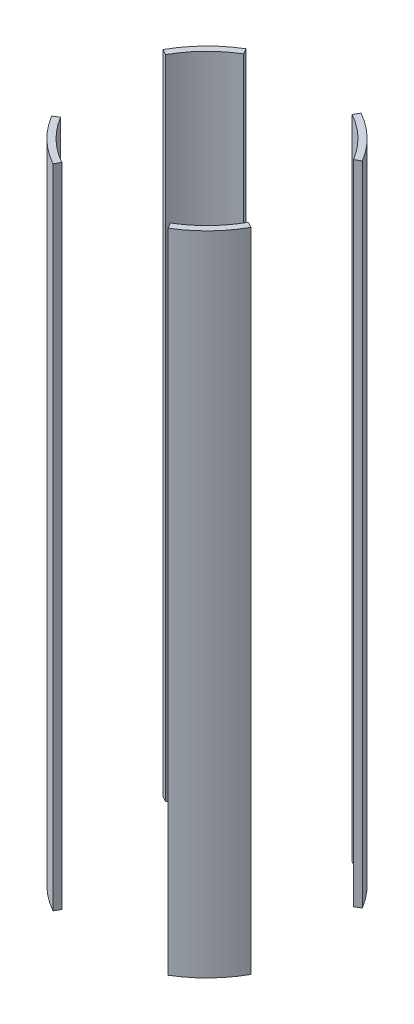
from build123d import *

# Parameters (mm, degrees)
SKETCH2_R               = 88.9
SKETCH2_R_2             = 83.82
BOSS_EXTRUDE1_DEPTH     = 254
CUT_EXTRUDE1_DEPTH      = 284.412102776
CUT_EXTRUDE1_DEPTH_BACK = 284.412102776


with BuildPart() as part:
    # Sketch2 → Boss-Extrude1 (new, symmetric)
    with BuildSketch(Plane(origin=(0, 0, 0), x_dir=(1, 0, 0), z_dir=(0, 1, 0))):
        Circle(SKETCH2_R)
        Circle(SKETCH2_R_2, mode=Mode.SUBTRACT)
    extrude(amount=BOSS_EXTRUDE1_DEPTH, both=True)

    # Sketch3 → Cut-Extrude1 (cut, two sides: drawn at the far end of the back side and taken through both)
    with BuildSketch(Plane(origin=(0, 0, 0), x_dir=(1, 0, 0), z_dir=(0, 1, 0)).offset(-CUT_EXTRUDE1_DEPTH_BACK)):
        Polygon((-58.116685864, 96.974944394), (0, 0), (53.900027233, 96.974944394), align=None)
        Polygon((70.991745134, -118.45858783), (0, 0), (-65.840936026, -118.45858783), align=None)
        Polygon((169.661755759, 101.677593364), (0, 0), (169.661755759, -94.300371224), align=None)
        Polygon((-123.741299607, -74.157652604), (0, 0), (-123.741299607, 68.777140945), align=None)
    extrude(amount=CUT_EXTRUDE1_DEPTH + CUT_EXTRUDE1_DEPTH_BACK, mode=Mode.SUBTRACT)


with BuildPart() as cut_extrude1_piece_1:
    # of the separate pieces the step leaves, piece 1, a body of its own (cut_extrude1_pieces)
    add(part.part.solids().sort_by_distance((-45.699187432, -254, -76.254798328))[0])


with BuildPart() as cut_extrude1_piece_2:
    # of the separate pieces the step leaves, piece 2, a body of its own (cut_extrude1_pieces)
    add(part.part.solids().sort_by_distance((45.699187432, -254, 76.254798328))[0])


with BuildPart() as cut_extrude1_piece_3:
    # of the separate pieces the step leaves, piece 3, a body of its own (cut_extrude1_pieces)
    add(part.part.solids().sort_by_distance((76.254798328, -254, -45.699187432))[0])


with BuildPart() as cut_extrude1_piece_4:
    # of the separate pieces the step leaves, piece 4, a body of its own (cut_extrude1_pieces)
    add(part.part.solids().sort_by_distance((-76.254798328, -254, 45.699187432))[0])


solid = Compound([cut_extrude1_piece_1.part, cut_extrude1_piece_2.part, cut_extrude1_piece_3.part, cut_extrude1_piece_4.part])
